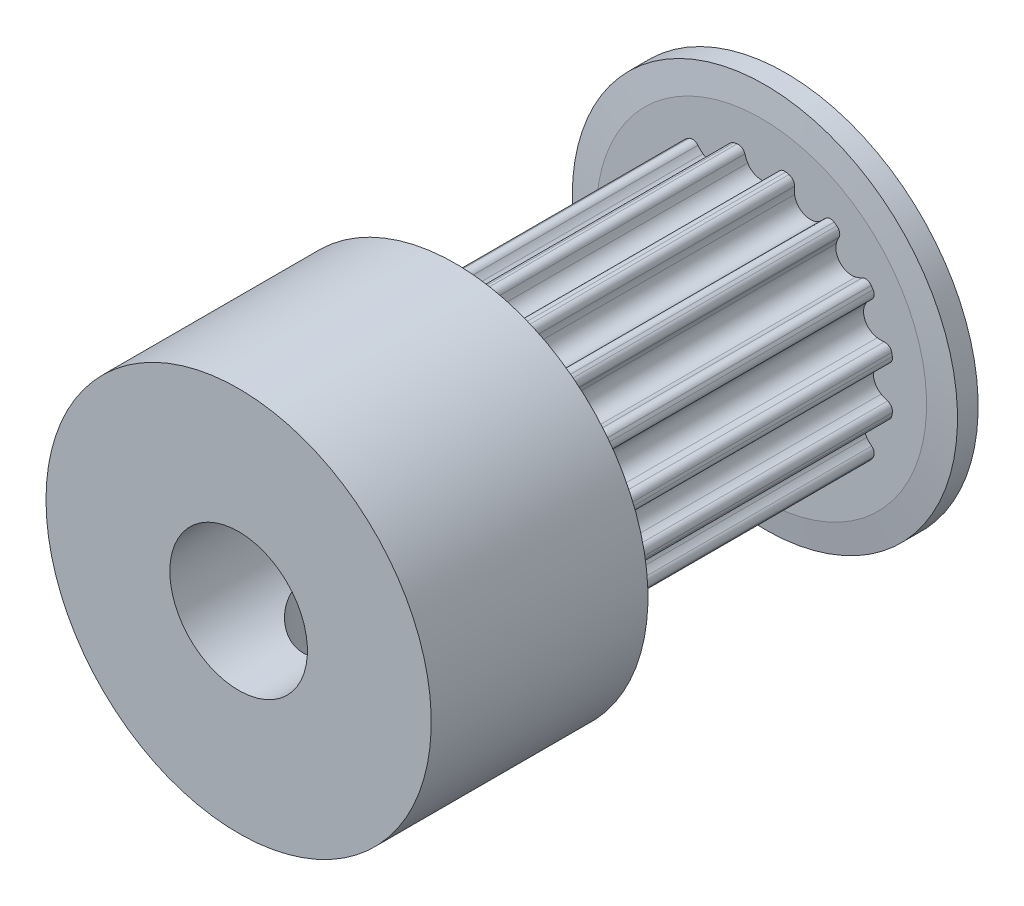
from build123d import *

# Parameters (mm, degrees)
SKETCH2_R                = 4.838958179
PULLEY_BODY_DEPTH        = 5.5
TOOTH_CUT_DEPTH          = 9.779580429
CIRPATTERN1_START        = -5.5
CIRPATTERN1_DEPTH        = 11
BOSS_EXTRUDE1_START      = -0.125
SKETCH16_R               = 7
BOSS_EXTRUDE1_DEPTH      = 7.125
F_5_0_5_DIAMETER_HOLE1_D = 5
M4_TAPPED_HOLE1_REACH    = 24.383
M4_TAPPED_HOLE1_BORE_R   = 1.65


# Read off the part's stored shape, not the designer's step: CirPattern1
with BuildPart() as part:
    # Sketch2 → Pulley Body (new, symmetric)
    with BuildSketch(Plane.XY):
        Circle(SKETCH2_R)
    extrude(amount=PULLEY_BODY_DEPTH, both=True)

    # Enlarged Cutout → Tooth Cut (cut, symmetric)
    with BuildSketch(Plane.XY):
        with BuildLine():
            ThreePointArc((0.886002865, 4.757154105), (0, 4.838958179), (-0.886002865, 4.757154105))
            ThreePointArc((-0.886002865, 4.757154105), (-0.709397154, 4.724413726), (-0.600324459, 4.581708936))
            ThreePointArc((-0.600324459, 4.581708936), (-0.557150257, 4.462363851), (-0.499558176, 4.349269141))
            ThreePointArc((-0.499558176, 4.349269141), (0, 4.063958179), (0.499558176, 4.349269141))
            ThreePointArc((0.499558176, 4.349269141), (0.557150257, 4.462363851), (0.600324459, 4.581708936))
            ThreePointArc((0.600324459, 4.581708936), (0.709397154, 4.724413726), (0.886002865, 4.757154105))
        make_face()
    extrude(amount=TOOTH_CUT_DEPTH, both=True, mode=Mode.SUBTRACT)

    # CirPattern1 outline → CirPattern1 (cut)
    with BuildSketch(Plane.XY.offset(CIRPATTERN1_START)):
        with BuildLine():
            ThreePointArc((2.307971583, 4.003212885), (2.463352371, 4.093314607), (2.639043974, 4.055978693))
            ThreePointArc((2.639043974, 4.055978693), (1.851789125, 4.47061442), (1.001924148, 4.734095928))
            ThreePointArc((1.001924148, 4.734095928), (1.15255735, 4.636263682), (1.198716621, 4.462681334))
            ThreePointArc((1.198716621, 4.462681334), (1.192932996, 4.335898801), (1.202861669, 4.209373379))
            ThreePointArc((1.202861669, 4.209373379), (1.555209465, 3.754607783), (2.125924817, 3.827028104))
            ThreePointArc((2.125924817, 3.827028104), (2.222412434, 3.909474456), (2.307971583, 4.003212885))
        make_face()
        with BuildLine():
            ThreePointArc((3.664250954, 2.815263962), (3.842284521, 2.839045445), (3.990314561, 2.737317293))
            ThreePointArc((3.990314561, 2.737317293), (3.421660142, 3.421660142), (2.737317293, 3.990314561))
            ThreePointArc((2.737317293, 3.990314561), (2.839045445, 3.842284521), (2.815263962, 3.664250954))
            ThreePointArc((2.815263962, 3.664250954), (2.761403015, 3.549332464), (2.722156729, 3.428638677))
            ThreePointArc((2.722156729, 3.428638677), (2.873652387, 2.873652387), (3.428638677, 2.722156729))
            ThreePointArc((3.428638677, 2.722156729), (3.549332464, 2.761403015), (3.664250954, 2.815263962))
        make_face()
        with BuildLine():
            ThreePointArc((4.462681334, 1.198716621), (4.636263682, 1.15255735), (4.734095928, 1.001924148))
            ThreePointArc((4.734095928, 1.001924148), (4.47061442, 1.851789125), (4.055978693, 2.639043974))
            ThreePointArc((4.055978693, 2.639043974), (4.093314607, 2.463352371), (4.003212885, 2.307971583))
            ThreePointArc((4.003212885, 2.307971583), (3.909474456, 2.222412434), (3.827028104, 2.125924817))
            ThreePointArc((3.827028104, 2.125924817), (3.754607783, 1.555209465), (4.209373379, 1.202861669))
            ThreePointArc((4.209373379, 1.202861669), (4.335898801, 1.192932996), (4.462681334, 1.198716621))
        make_face()
        with BuildLine():
            ThreePointArc((4.581708936, -0.600324459), (4.724413726, -0.709397154), (4.757154105, -0.886002865))
            ThreePointArc((4.757154105, -0.886002865), (4.838958179, 0), (4.757154105, 0.886002865))
            ThreePointArc((4.757154105, 0.886002865), (4.724413726, 0.709397154), (4.581708936, 0.600324459))
            ThreePointArc((4.581708936, 0.600324459), (4.462363851, 0.557150257), (4.349269141, 0.499558176))
            ThreePointArc((4.349269141, 0.499558176), (4.063958179, 0), (4.349269141, -0.499558176))
            ThreePointArc((4.349269141, -0.499558176), (4.462363851, -0.557150257), (4.581708936, -0.600324459))
        make_face()
        with BuildLine():
            ThreePointArc((4.003212885, -2.307971583), (4.093314607, -2.463352371), (4.055978693, -2.639043974))
            ThreePointArc((4.055978693, -2.639043974), (4.47061442, -1.851789125), (4.734095928, -1.001924148))
            ThreePointArc((4.734095928, -1.001924148), (4.636263682, -1.15255735), (4.462681334, -1.198716621))
            ThreePointArc((4.462681334, -1.198716621), (4.335898801, -1.192932996), (4.209373379, -1.202861669))
            ThreePointArc((4.209373379, -1.202861669), (3.754607783, -1.555209465), (3.827028104, -2.125924817))
            ThreePointArc((3.827028104, -2.125924817), (3.909474456, -2.222412434), (4.003212885, -2.307971583))
        make_face()
        with BuildLine():
            ThreePointArc((2.815263962, -3.664250954), (2.839045445, -3.842284521), (2.737317293, -3.990314561))
            ThreePointArc((2.737317293, -3.990314561), (3.421660142, -3.421660142), (3.990314561, -2.737317293))
            ThreePointArc((3.990314561, -2.737317293), (3.842284521, -2.839045445), (3.664250954, -2.815263962))
            ThreePointArc((3.664250954, -2.815263962), (3.549332464, -2.761403015), (3.428638677, -2.722156729))
            ThreePointArc((3.428638677, -2.722156729), (2.873652387, -2.873652387), (2.722156729, -3.428638677))
            ThreePointArc((2.722156729, -3.428638677), (2.761403015, -3.549332464), (2.815263962, -3.664250954))
        make_face()
        with BuildLine():
            ThreePointArc((1.198716621, -4.462681334), (1.15255735, -4.636263682), (1.001924148, -4.734095928))
            ThreePointArc((1.001924148, -4.734095928), (1.851789125, -4.47061442), (2.639043974, -4.055978693))
            ThreePointArc((2.639043974, -4.055978693), (2.463352371, -4.093314607), (2.307971583, -4.003212885))
            ThreePointArc((2.307971583, -4.003212885), (2.222412434, -3.909474456), (2.125924817, -3.827028104))
            ThreePointArc((2.125924817, -3.827028104), (1.555209465, -3.754607783), (1.202861669, -4.209373379))
            ThreePointArc((1.202861669, -4.209373379), (1.192932996, -4.335898801), (1.198716621, -4.462681334))
        make_face()
        with BuildLine():
            ThreePointArc((-0.600324459, -4.581708936), (-0.709397154, -4.724413726), (-0.886002865, -4.757154105))
            ThreePointArc((-0.886002865, -4.757154105), (0, -4.838958179), (0.886002865, -4.757154105))
            ThreePointArc((0.886002865, -4.757154105), (0.709397154, -4.724413726), (0.600324459, -4.581708936))
            ThreePointArc((0.600324459, -4.581708936), (0.557150257, -4.462363851), (0.499558176, -4.349269141))
            ThreePointArc((0.499558176, -4.349269141), (0, -4.063958179), (-0.499558176, -4.349269141))
            ThreePointArc((-0.499558176, -4.349269141), (-0.557150257, -4.462363851), (-0.600324459, -4.581708936))
        make_face()
        with BuildLine():
            ThreePointArc((-2.307971583, -4.003212885), (-2.463352371, -4.093314607), (-2.639043974, -4.055978693))
            ThreePointArc((-2.639043974, -4.055978693), (-1.851789125, -4.47061442), (-1.001924148, -4.734095928))
            ThreePointArc((-1.001924148, -4.734095928), (-1.15255735, -4.636263682), (-1.198716621, -4.462681334))
            ThreePointArc((-1.198716621, -4.462681334), (-1.192932996, -4.335898801), (-1.202861669, -4.209373379))
            ThreePointArc((-1.202861669, -4.209373379), (-1.555209465, -3.754607783), (-2.125924817, -3.827028104))
            ThreePointArc((-2.125924817, -3.827028104), (-2.222412434, -3.909474456), (-2.307971583, -4.003212885))
        make_face()
        with BuildLine():
            ThreePointArc((-3.664250954, -2.815263962), (-3.842284521, -2.839045445), (-3.990314561, -2.737317293))
            ThreePointArc((-3.990314561, -2.737317293), (-3.421660142, -3.421660142), (-2.737317293, -3.990314561))
            ThreePointArc((-2.737317293, -3.990314561), (-2.839045445, -3.842284521), (-2.815263962, -3.664250954))
            ThreePointArc((-2.815263962, -3.664250954), (-2.761403015, -3.549332464), (-2.722156729, -3.428638677))
            ThreePointArc((-2.722156729, -3.428638677), (-2.873652387, -2.873652387), (-3.428638677, -2.722156729))
            ThreePointArc((-3.428638677, -2.722156729), (-3.549332464, -2.761403015), (-3.664250954, -2.815263962))
        make_face()
        with BuildLine():
            ThreePointArc((-4.462681334, -1.198716621), (-4.636263682, -1.15255735), (-4.734095928, -1.001924148))
            ThreePointArc((-4.734095928, -1.001924148), (-4.47061442, -1.851789125), (-4.055978693, -2.639043974))
            ThreePointArc((-4.055978693, -2.639043974), (-4.093314607, -2.463352371), (-4.003212885, -2.307971583))
            ThreePointArc((-4.003212885, -2.307971583), (-3.909474456, -2.222412434), (-3.827028104, -2.125924817))
            ThreePointArc((-3.827028104, -2.125924817), (-3.754607783, -1.555209465), (-4.209373379, -1.202861669))
            ThreePointArc((-4.209373379, -1.202861669), (-4.335898801, -1.192932996), (-4.462681334, -1.198716621))
        make_face()
        with BuildLine():
            ThreePointArc((-4.581708936, 0.600324459), (-4.724413726, 0.709397154), (-4.757154105, 0.886002865))
            ThreePointArc((-4.757154105, 0.886002865), (-4.838958179, 0), (-4.757154105, -0.886002865))
            ThreePointArc((-4.757154105, -0.886002865), (-4.724413726, -0.709397154), (-4.581708936, -0.600324459))
            ThreePointArc((-4.581708936, -0.600324459), (-4.462363851, -0.557150257), (-4.349269141, -0.499558176))
            ThreePointArc((-4.349269141, -0.499558176), (-4.063958179, 0), (-4.349269141, 0.499558176))
            ThreePointArc((-4.349269141, 0.499558176), (-4.462363851, 0.557150257), (-4.581708936, 0.600324459))
        make_face()
        with BuildLine():
            ThreePointArc((-4.003212885, 2.307971583), (-4.093314607, 2.463352371), (-4.055978693, 2.639043974))
            ThreePointArc((-4.055978693, 2.639043974), (-4.47061442, 1.851789125), (-4.734095928, 1.001924148))
            ThreePointArc((-4.734095928, 1.001924148), (-4.636263682, 1.15255735), (-4.462681334, 1.198716621))
            ThreePointArc((-4.462681334, 1.198716621), (-4.335898801, 1.192932996), (-4.209373379, 1.202861669))
            ThreePointArc((-4.209373379, 1.202861669), (-3.754607783, 1.555209465), (-3.827028104, 2.125924817))
            ThreePointArc((-3.827028104, 2.125924817), (-3.909474456, 2.222412434), (-4.003212885, 2.307971583))
        make_face()
        with BuildLine():
            ThreePointArc((-2.815263962, 3.664250954), (-2.839045445, 3.842284521), (-2.737317293, 3.990314561))
            ThreePointArc((-2.737317293, 3.990314561), (-3.421660142, 3.421660142), (-3.990314561, 2.737317293))
            ThreePointArc((-3.990314561, 2.737317293), (-3.842284521, 2.839045445), (-3.664250954, 2.815263962))
            ThreePointArc((-3.664250954, 2.815263962), (-3.549332464, 2.761403015), (-3.428638677, 2.722156729))
            ThreePointArc((-3.428638677, 2.722156729), (-2.873652387, 2.873652387), (-2.722156729, 3.428638677))
            ThreePointArc((-2.722156729, 3.428638677), (-2.761403015, 3.549332464), (-2.815263962, 3.664250954))
        make_face()
        with BuildLine():
            ThreePointArc((-1.198716621, 4.462681334), (-1.15255735, 4.636263682), (-1.001924148, 4.734095928))
            ThreePointArc((-1.001924148, 4.734095928), (-1.851789125, 4.47061442), (-2.639043974, 4.055978693))
            ThreePointArc((-2.639043974, 4.055978693), (-2.463352371, 4.093314607), (-2.307971583, 4.003212885))
            ThreePointArc((-2.307971583, 4.003212885), (-2.222412434, 3.909474456), (-2.125924817, 3.827028104))
            ThreePointArc((-2.125924817, 3.827028104), (-1.555209465, 3.754607783), (-1.202861669, 4.209373379))
            ThreePointArc((-1.202861669, 4.209373379), (-1.192932996, 4.335898801), (-1.198716621, 4.462681334))
        make_face()
    extrude(amount=CIRPATTERN1_DEPTH, mode=Mode.SUBTRACT)

    # Sketch15 → Revolve1 (revolve)
    with BuildSketch(Plane(origin=(0, 0, 0), x_dir=(1, 0, 0), z_dir=(0, 1, 0))):
        Polygon((-6, -5.5), (0, -5.5), (0, -6.5), (-6, -6.5), (-7, -6.375), (-7, -5.625), align=None)
    revolve1 = revolve(axis=Axis((0, 0, 6.5), (0, 0, 1)))

    # Mirror7: Revolve1 across plane
    add(revolve1.mirror(Plane.XY))

    # Sketch16 → Boss-Extrude1 (add)
    with BuildSketch(Plane.XY.offset(6.5).offset(BOSS_EXTRUDE1_START)):
        with Locations(Location((0, 0, 0), (0, 0, 180))):
            Circle(SKETCH16_R)
    extrude(amount=BOSS_EXTRUDE1_DEPTH)

    # Ø5.0 (5) Diameter Hole1 (through all)
    with Locations(Plane(origin=(0, 0, -6.5), x_dir=(1, 0, 0), z_dir=(0, 0, -1))):
        with Locations((0, 0)):
            Hole(F_5_0_5_DIAMETER_HOLE1_D / 2)

    # M4 Tapped Hole1 bore (on position points) → M4 Tapped Hole1 (cut, up to next)
    with BuildSketch(Plane(origin=(0, -7, 9.5), x_dir=(-1, 0, 0), z_dir=(0, -1, 0)), mode=Mode.PRIVATE) as m4_tapped_hole1_sk1:
        Circle(M4_TAPPED_HOLE1_BORE_R)
    m4_tapped_hole1_tool1 = extrude(m4_tapped_hole1_sk1.sketch, amount=-M4_TAPPED_HOLE1_REACH, mode=Mode.PRIVATE) & part.part
    add(m4_tapped_hole1_tool1.solids().sort_by_distance((0, -7, 9.5))[0], mode=Mode.SUBTRACT)


solid = part.part
